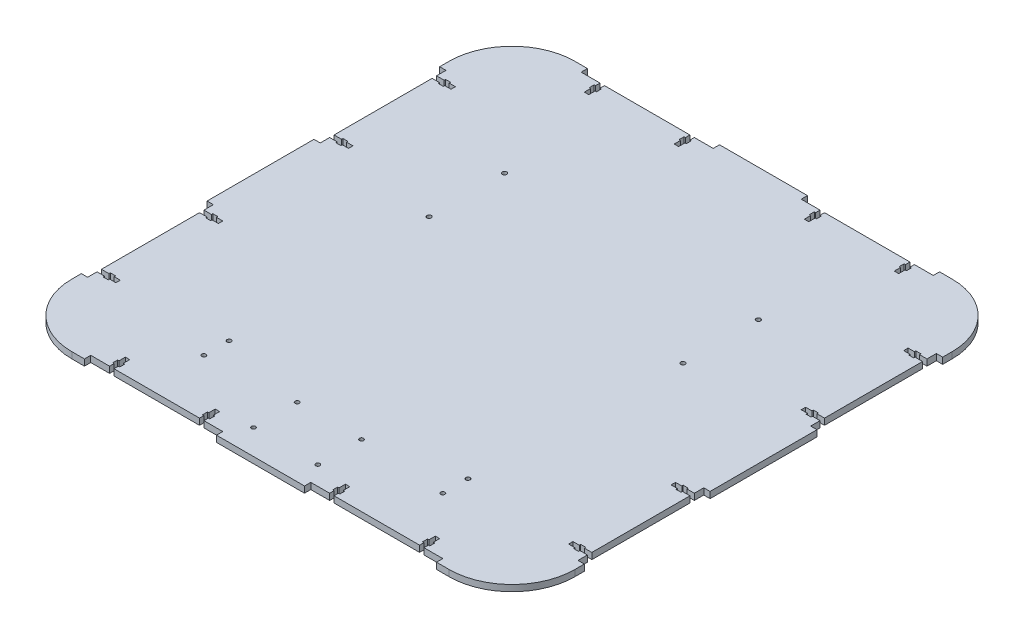
from build123d import *

# Parameters (mm, degrees)
SKETCH1_W           = 400
SKETCH1_H           = 400
SKETCH1_R           = 1.75
BOSS_EXTRUDE2_DEPTH = 5
FILLET1_R           = 50
CUT_EXTRUDE8_DEPTH  = 10
SKETCH11_W          = 105
SKETCH11_H          = 5
CUT_EXTRUDE9_DEPTH  = 10
CUT_EXTRUDE10_DEPTH = 5
SKETCH13_W          = 5
SKETCH13_H          = 100
CUT_EXTRUDE11_DEPTH = 5
SKETCH15_R          = 1.75
CUT_EXTRUDE13_DEPTH = 10
SKETCH16_R          = 1.65
CUT_EXTRUDE15_DEPTH = 10
SKETCH17_R          = 1.65
CUT_EXTRUDE16_DEPTH = 10
SKETCH18_W          = 25
SKETCH18_H          = 25
BOSS_EXTRUDE3_DEPTH = 3


with BuildPart() as part:
    # Sketch1 → Boss-Extrude2 (new body)
    with BuildSketch(Plane(origin=(0, 0, 0), x_dir=(1, 0, 0), z_dir=(0, 1, 0))):
        Rectangle(SKETCH1_W, SKETCH1_H)
        with Locations((-7.5, -187.5)):
            Circle(SKETCH1_R, mode=Mode.SUBTRACT)
        with Locations((-7.5, -172.5)):
            Circle(SKETCH1_R, mode=Mode.SUBTRACT)
        with Locations((7.5, -187.5)):
            Circle(SKETCH1_R, mode=Mode.SUBTRACT)
        with Locations((7.5, -172.5)):
            Circle(SKETCH1_R, mode=Mode.SUBTRACT)
    extrude(amount=BOSS_EXTRUDE2_DEPTH)

    # Fillet1
    fillet1_edges = [part.edges().sort_by_distance(p)[0] for p in [
        (200, 2.5, -200),
        (200, 2.5, 200),
        (-200, 2.5, 200),
        (-200, 2.5, -200),
    ]]
    fillet(fillet1_edges, radius=FILLET1_R)

    # Sketch10 → Cut-Extrude8 (cut)
    with BuildSketch(Plane(origin=(0, 5, 0), x_dir=(1, 0, 0), z_dir=(0, 1, 0))):
        Polygon((-125, -200), (-121.5, -200), (-121.5, -191.5), (-120.4, -191.5), (-120.4, -187.5), (-121.5, -187.5), (-121.5, -182.5), (-125, -182.5), (-125, -187.5), (-126.1, -187.5), (-126.1, -191.5), (-125, -191.5), align=None)
        Polygon((-53.5, -200), (-50, -200), (-50, -191.5), (-48.9, -191.5), (-48.9, -187.5), (-50, -187.5), (-50, -182.5), (-53.5, -182.5), (-53.5, -187.5), (-54.6, -187.5), (-54.6, -191.5), (-53.5, -191.5), align=None)
        Polygon((125, -200), (125, -191.5), (126.1, -191.5), (126.1, -187.5), (125, -187.5), (125, -182.5), (121.5, -182.5), (121.5, -187.5), (120.4, -187.5), (120.4, -191.5), (121.5, -191.5), (121.5, -200), align=None)
        Polygon((53.5, -200), (53.5, -191.5), (54.6, -191.5), (54.6, -187.5), (53.5, -187.5), (53.5, -182.5), (50, -182.5), (50, -187.5), (48.9, -187.5), (48.9, -191.5), (50, -191.5), (50, -200), align=None)
        Polygon((125, 200), (121.5, 200), (121.5, 191.5), (120.4, 191.5), (120.4, 187.5), (121.5, 187.5), (121.5, 182.5), (125, 182.5), (125, 187.5), (126.1, 187.5), (126.1, 191.5), (125, 191.5), align=None)
        Polygon((53.5, 200), (50, 200), (50, 191.5), (48.9, 191.5), (48.9, 187.5), (50, 187.5), (50, 182.5), (53.5, 182.5), (53.5, 187.5), (54.6, 187.5), (54.6, 191.5), (53.5, 191.5), align=None)
        Polygon((-53.5, 200), (-53.5, 191.5), (-54.6, 191.5), (-54.6, 187.5), (-53.5, 187.5), (-53.5, 182.5), (-50, 182.5), (-50, 187.5), (-48.9, 187.5), (-48.9, 191.5), (-50, 191.5), (-50, 200), align=None)
        Polygon((-125, 200), (-125, 191.5), (-126.1, 191.5), (-126.1, 187.5), (-125, 187.5), (-125, 182.5), (-121.5, 182.5), (-121.5, 187.5), (-120.4, 187.5), (-120.4, 191.5), (-121.5, 191.5), (-121.5, 200), align=None)
    extrude(amount=-CUT_EXTRUDE8_DEPTH, mode=Mode.SUBTRACT)

    # Sketch11 → Cut-Extrude9 (cut)
    with BuildSketch(Plane(origin=(0, 5, 0), x_dir=(1, 0, 0), z_dir=(0, 1, 0))):
        with Locations((-87.5, -197.5)):
            Rectangle(SKETCH11_W, SKETCH11_H)
        with Locations((87.5, -197.5)):
            Rectangle(SKETCH11_W, SKETCH11_H)
        with Locations((87.5, 197.5)):
            Rectangle(SKETCH11_W, SKETCH11_H)
        with Locations((-87.5, 197.5)):
            Rectangle(SKETCH11_W, SKETCH11_H)
    extrude(amount=-CUT_EXTRUDE9_DEPTH, mode=Mode.SUBTRACT)

    # Sketch12 → Cut-Extrude10 (cut)
    with BuildSketch(Plane(origin=(0, 5, 0), x_dir=(1, 0, 0), z_dir=(0, 1, 0))):
        Polygon((-200, 135), (-189, 135), (-189, 136.1), (-185, 136.1), (-185, 135), (-180, 135), (-180, 131.5), (-185, 131.5), (-185, 130.4), (-189, 130.4), (-189, 131.5), (-200, 131.5), align=None)
        Polygon((-200, 53.5), (-189, 53.5), (-189, 54.6), (-185, 54.6), (-185, 53.5), (-180, 53.5), (-180, 50), (-185, 50), (-185, 48.9), (-189, 48.9), (-189, 50), (-200, 50), align=None)
        Polygon((-200, -53.5), (-200, -50), (-189, -50), (-189, -48.9), (-185, -48.9), (-185, -50), (-180, -50), (-180, -53.5), (-185, -53.5), (-185, -54.6), (-189, -54.6), (-189, -53.5), align=None)
        Polygon((-200, -135), (-200, -131.5), (-189, -131.5), (-189, -130.4), (-185, -130.4), (-185, -131.5), (-180, -131.5), (-180, -135), (-185, -135), (-185, -136.1), (-189, -136.1), (-189, -135), align=None)
        Polygon((200, -135), (189, -135), (189, -136.1), (185, -136.1), (185, -135), (180, -135), (180, -131.5), (185, -131.5), (185, -130.4), (189, -130.4), (189, -131.5), (200, -131.5), align=None)
        Polygon((200, -53.5), (189, -53.5), (189, -54.6), (185, -54.6), (185, -53.5), (180, -53.5), (180, -50), (185, -50), (185, -48.9), (189, -48.9), (189, -50), (200, -50), align=None)
        Polygon((200, 53.5), (200, 50), (189, 50), (189, 48.9), (185, 48.9), (185, 50), (180, 50), (180, 53.5), (185, 53.5), (185, 54.6), (189, 54.6), (189, 53.5), align=None)
        Polygon((200, 135), (200, 131.5), (189, 131.5), (189, 130.4), (185, 130.4), (185, 131.5), (180, 131.5), (180, 135), (185, 135), (185, 136.1), (189, 136.1), (189, 135), align=None)
    extrude(amount=-CUT_EXTRUDE10_DEPTH, mode=Mode.SUBTRACT)

    # Sketch13 → Cut-Extrude11 (cut)
    with BuildSketch(Plane(origin=(0, 5, 0), x_dir=(1, 0, 0), z_dir=(0, 1, 0))):
        with Locations((-197.5, 92.5)):
            Rectangle(SKETCH13_W, SKETCH13_H)
        with Locations((-197.5, -92.5)):
            Rectangle(SKETCH13_W, SKETCH13_H)
        with Locations((197.5, -92.5)):
            Rectangle(SKETCH13_W, SKETCH13_H)
        with Locations((197.5, 92.5)):
            Rectangle(SKETCH13_W, SKETCH13_H)
    extrude(amount=-CUT_EXTRUDE11_DEPTH, mode=Mode.SUBTRACT)

    # Sketch15 → Cut-Extrude13 (cut)
    with BuildSketch(Plane(origin=(0, 5, 0), x_dir=(1, 0, 0), z_dir=(0, 1, 0))):
        with Locations((-100.9, 95)):
            Circle(SKETCH15_R)
        with Locations((-100.9, 35)):
            Circle(SKETCH15_R)
        with Locations((100.9, 35)):
            Circle(SKETCH15_R)
        with Locations((100.9, 95)):
            Circle(SKETCH15_R)
    extrude(amount=-CUT_EXTRUDE13_DEPTH, mode=Mode.SUBTRACT)

    # Sketch16 → Cut-Extrude15 (cut)
    with BuildSketch(Plane(origin=(0, 5, 0), x_dir=(1, 0, 0), z_dir=(0, 1, 0))):
        with Locations((-25.585, -145.25)):
            Circle(SKETCH16_R)
        with Locations((25.585, -145.25)):
            Circle(SKETCH16_R)
        with Locations((25.585, -180)):
            Circle(SKETCH16_R)
        with Locations((-25.585, -180)):
            Circle(SKETCH16_R)
    extrude(amount=-CUT_EXTRUDE15_DEPTH, mode=Mode.SUBTRACT)

    # Sketch17 → Cut-Extrude16 (cut)
    with BuildSketch(Plane(origin=(0, 5, 0), x_dir=(1, 0, 0), z_dir=(0, 1, 0))):
        with Locations((-95, -130)):
            Circle(SKETCH17_R)
        with Locations((-95, -150)):
            Circle(SKETCH17_R)
        with Locations((95, -130)):
            Circle(SKETCH17_R)
        with Locations((95, -150)):
            Circle(SKETCH17_R)
    extrude(amount=-CUT_EXTRUDE16_DEPTH, mode=Mode.SUBTRACT)

    # Sketch18 → Boss-Extrude3 (add)
    with BuildSketch(Plane(origin=(0, 5, 0), x_dir=(1, 0, 0), z_dir=(0, 1, 0))):
        with Locations((0, -180)):
            Rectangle(SKETCH18_W, SKETCH18_H)
    extrude(amount=-BOSS_EXTRUDE3_DEPTH)


solid = part.part
